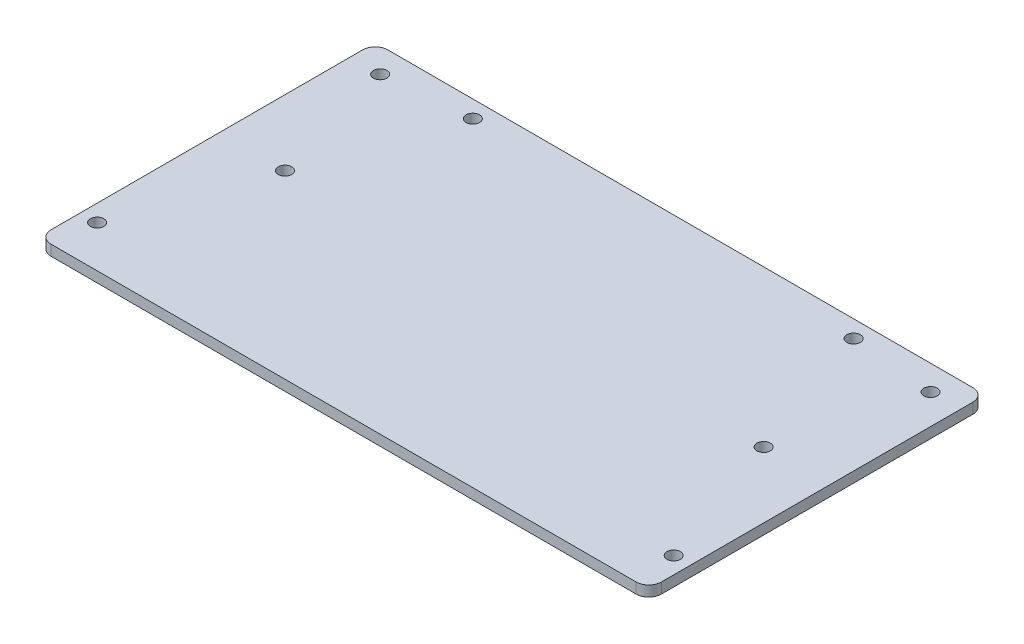
from build123d import *

# Parameters (mm, degrees)
SKETCH1_W           = 184.15
SKETCH1_H           = 101.6
BOSS_EXTRUDE1_DEPTH = 3.175
FILLET1_R           = 3.81
SKETCH2_R           = 2.032
CUT_EXTRUDE1_DEPTH  = 211.342252353


with BuildPart() as part:
    # Sketch1 → Boss-Extrude1 (new body)
    with BuildSketch(Plane(origin=(0, 0, 0), x_dir=(1, 0, 0), z_dir=(0, 1, 0))):
        with Locations((92.075, -50.8)):
            Rectangle(SKETCH1_W, SKETCH1_H)
    extrude(amount=BOSS_EXTRUDE1_DEPTH)

    # Fillet1
    fillet1_edges = [part.edges().sort_by_distance(p)[0] for p in [
        (184.15, 1.5875, 0),
        (184.15, 1.5875, 101.6),
        (0, 1.5875, 0),
        (0, 1.5875, 101.6),
    ]]
    fillet(fillet1_edges, radius=FILLET1_R)

    # Sketch2 → Cut-Extrude1 (cut, through all)
    with BuildSketch(Plane(origin=(0, 3.175, 0), x_dir=(1, 0, 0), z_dir=(0, 1, 0))):
        with Locations((5.072532889, -89.007136361)):
            Circle(SKETCH2_R)
        with Locations((19.845641406, -47.083899788)):
            Circle(SKETCH2_R)
        with Locations((34.618749924, -5.160663215)):
            Circle(SKETCH2_R)
        with Locations((9.034778811, -7.531539276)):
            Circle(SKETCH2_R)
        with Locations((179.077467111, -89.007136361)):
            Circle(SKETCH2_R)
        with Locations((164.304358594, -47.083899788)):
            Circle(SKETCH2_R)
        with Locations((175.115221189, -7.531539276)):
            Circle(SKETCH2_R)
        with Locations((149.531250076, -5.160663215)):
            Circle(SKETCH2_R)
    extrude(amount=-CUT_EXTRUDE1_DEPTH, mode=Mode.SUBTRACT)


solid = part.part
